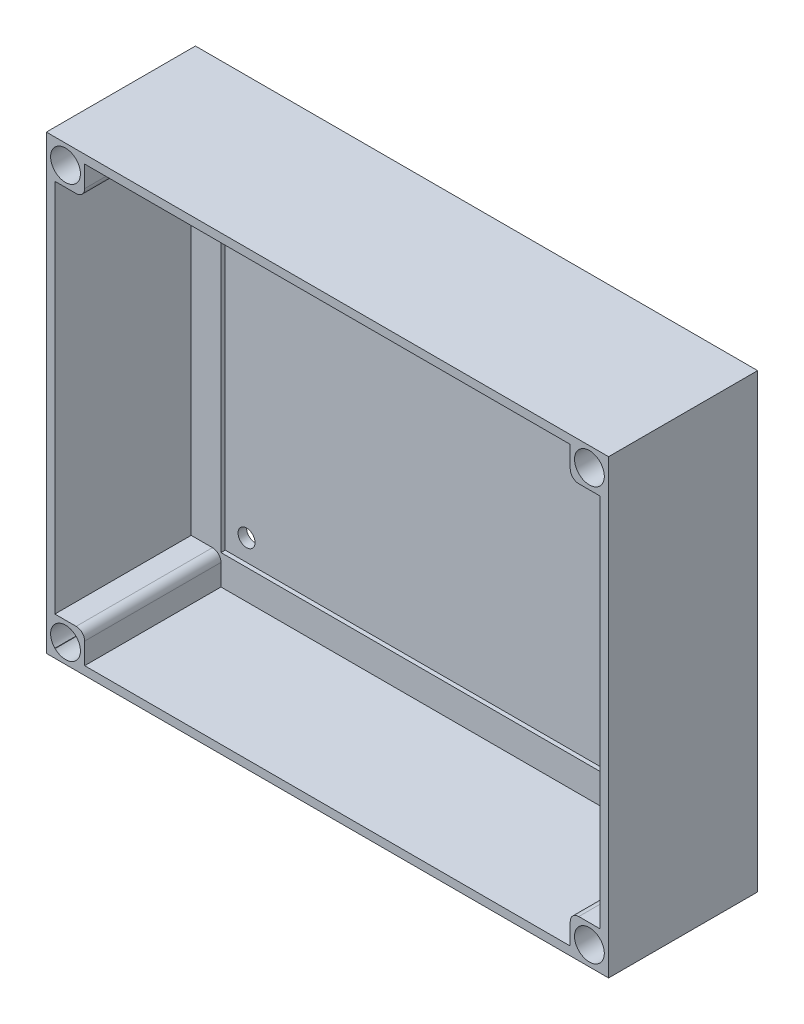
from build123d import *

# Parameters (mm, degrees)
ESQUISSE1_R             = 2
BOSS_EXTRU_1_DEPTH      = 2
ESQUISSE1_3_W           = 132
ESQUISSE1_3_H           = 106
ESQUISSE1_3_W_2         = 114
ESQUISSE1_3_H_2         = 88
BOSS_EXTRU_2_DEPTH      = 3
ESQUISSE2_W             = 132
ESQUISSE2_H             = 106
BOSS_EXTRU_4_DEPTH      = 32
ENL_V_START             = -5
ESQUISSE3_R             = 3.5
ENL_V_MAT_EXTRU_1_DEPTH = 5
CONG_1_R                = 2


with BuildPart() as part:
    # Esquisse1 → Boss.-Extru.1 (new body)
    with BuildSketch(Plane.XY):
        Polygon((63, 78), (43, 78), (43, 84.300950417), (43, 88), (0, 88), (0, 0), (114, 0), (114, 88), (63, 88), (63, 84.300950417), align=None)
        with Locations((5, 5)):
            Circle(ESQUISSE1_R, mode=Mode.SUBTRACT)
        with Locations((109, 5)):
            Circle(ESQUISSE1_R, mode=Mode.SUBTRACT)
        with Locations((5, 83)):
            Circle(ESQUISSE1_R, mode=Mode.SUBTRACT)
        with Locations((109, 83)):
            Circle(ESQUISSE1_R, mode=Mode.SUBTRACT)
    extrude(amount=BOSS_EXTRU_1_DEPTH)

    # Esquisse1<3> → Boss.-Extru.2 (add)
    with BuildSketch(Plane.XY):
        with Locations((57, 44)):
            Rectangle(ESQUISSE1_3_W, ESQUISSE1_3_H)
        with Locations((57, 44)):
            Rectangle(ESQUISSE1_3_W_2, ESQUISSE1_3_H_2, mode=Mode.SUBTRACT)
    extrude(amount=BOSS_EXTRU_2_DEPTH)

    # Esquisse2 → Boss.-Extru.4 (add)
    with BuildSketch(Plane.XY.offset(3)):
        with Locations((57, 44)):
            Rectangle(ESQUISSE2_W, ESQUISSE2_H)
        with BuildLine():
            Line((-7, -7), (-7, -6.949489743))
            ThreePointArc((-7, -6.949489743), (-6.974873734, -6.974873734), (-6.949489743, -7))
            Line((-6.949489743, -7), (-7, -7))
        make_face(mode=Mode.SUBTRACT)
        Polygon((114, -7), (0, -7), (0, 0), (-7, 0), (-7, 88), (0, 88), (0, 95), (114, 95), (114, 88), (121, 88), (121, 0), (114, 0), align=None, mode=Mode.SUBTRACT)
        with BuildLine():
            ThreePointArc((120.949489743, -7), (120.974873734, -6.974873734), (121, -6.949489743))
            Line((121, -6.949489743), (121, -7))
            Line((121, -7), (120.949489743, -7))
        make_face(mode=Mode.SUBTRACT)
        with BuildLine():
            Line((-7, 95), (-6.949489743, 95))
            ThreePointArc((-6.949489743, 95), (-6.974873734, 94.974873734), (-7, 94.949489743))
            Line((-7, 94.949489743), (-7, 95))
        make_face(mode=Mode.SUBTRACT)
        with BuildLine():
            ThreePointArc((121, 94.949489743), (120.974873734, 94.974873734), (120.949489743, 95))
            Line((120.949489743, 95), (121, 95))
            Line((121, 95), (121, 94.949489743))
        make_face(mode=Mode.SUBTRACT)
    extrude(amount=BOSS_EXTRU_4_DEPTH)

    # Esquisse3 → Enlèv. mat.-Extru.1 (cut)
    with BuildSketch(Plane.XY.offset(35).offset(ENL_V_START)):
        with Locations((-4.5, 92.5)):
            Circle(ESQUISSE3_R)
        with Locations((118.5, 92.5)):
            Circle(ESQUISSE3_R)
        with Locations((118.5, -4.5)):
            Circle(ESQUISSE3_R)
        with Locations((-4.5, -4.5)):
            Circle(ESQUISSE3_R)
    extrude(amount=ENL_V_MAT_EXTRU_1_DEPTH, mode=Mode.SUBTRACT)

    # Congé1
    # the kernel refuses this fillet: 2 mm, written as the material it takes off along each edge
    with BuildSketch(Plane(origin=(114, 88, 3), x_dir=(0, 1, 0), z_dir=(0, 0, 1)), Plane(origin=(114, 0, 3), x_dir=(1, 0, 0), z_dir=(0, 0, 1))) as cong_1_piece_1:
        with BuildLine():
            CenterArc((CONG_1_R, -CONG_1_R), CONG_1_R, 90, 90)
            Line((0, -CONG_1_R), (0, 0))
            Line((0, 0), (CONG_1_R, 0))
        make_face()
    extrude(amount=37, mode=Mode.SUBTRACT)
    with BuildSketch(Plane(origin=(0, 0, 3), x_dir=(-1, 0, 0), z_dir=(0, 0, 1)), Plane(origin=(0, 88, 3), x_dir=(0, 1, 0), z_dir=(0, 0, 1))) as cong_1_piece_2:
        with BuildLine():
            CenterArc((CONG_1_R, CONG_1_R), CONG_1_R, 180, 90)
            Line((0, CONG_1_R), (0, 0))
            Line((0, 0), (CONG_1_R, 0))
        make_face()
    extrude(amount=37, mode=Mode.SUBTRACT)


solid = part.part
